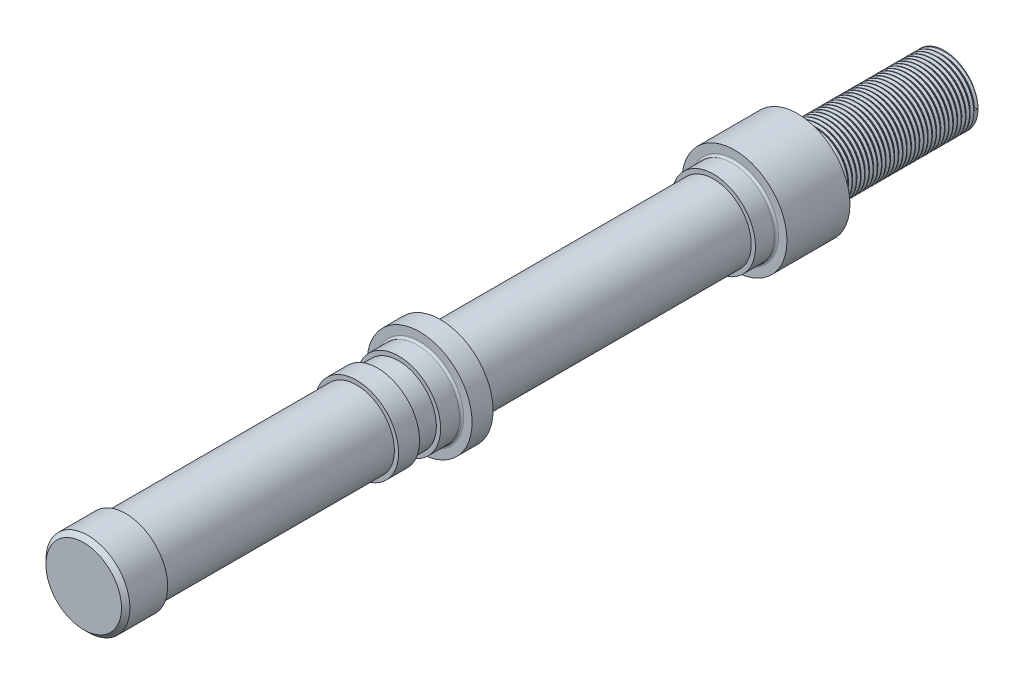
from build123d import *

# Parameters (mm, degrees)
SKETCH_1_R       = 8
EXTRUDE_1_DEPTH  = 35
SKETCH_2_R       = 12.5
EXTRUDE_2_DEPTH  = 15
SKETCH_3_R       = 10
EXTRUDE_3_DEPTH  = 5
SKETCH_4_R       = 9
EXTRUDE_4_DEPTH  = 65
SKETCH_5_R       = 12.5
EXTRUDE_5_DEPTH  = 5
SKETCH_6_R       = 10
EXTRUDE_6_DEPTH  = 5
SKETCH_7_R       = 9
EXTRUDE_7_DEPTH  = 5
SKETCH_8_R       = 10
EXTRUDE_8_DEPTH  = 5
SKETCH_9_R       = 9
EXTRUDE_9_DEPTH  = 55
SKETCH_10_R      = 10
EXTRUDE_10_DEPTH = 10
THREAD_1_PITCH   = 1
CHAMFER_1_SIZE   = 1
FILLET_1_R       = 0.5
FILLET_2_R       = 0.5


with BuildPart() as part:
    # Sketch 1 → ﾎﾞｽ - 押し出し1 (new body)
    with BuildSketch(Plane.XY):
        Circle(SKETCH_1_R)
    extrude(amount=EXTRUDE_1_DEPTH)

    # ｽｹｯﾁ2 → ﾎﾞｽ - 押し出し2 (add)
    with BuildSketch(Plane.XY.offset(35)):
        Circle(SKETCH_2_R)
    extrude(amount=EXTRUDE_2_DEPTH)

    # ｽｹｯﾁ3 → ﾎﾞｽ - 押し出し3 (add)
    with BuildSketch(Plane.XY.offset(50)):
        Circle(SKETCH_3_R)
    extrude(amount=EXTRUDE_3_DEPTH)

    # ｽｹｯﾁ4 → ﾎﾞｽ - 押し出し4 (add)
    with BuildSketch(Plane.XY.offset(55)):
        Circle(SKETCH_4_R)
    extrude(amount=EXTRUDE_4_DEPTH)

    # ｽｹｯﾁ5 → ﾎﾞｽ - 押し出し5 (add)
    with BuildSketch(Plane.XY.offset(120)):
        Circle(SKETCH_5_R)
    extrude(amount=EXTRUDE_5_DEPTH)

    # ｽｹｯﾁ6 → ﾎﾞｽ - 押し出し6 (add)
    with BuildSketch(Plane.XY.offset(125)):
        Circle(SKETCH_6_R)
    extrude(amount=EXTRUDE_6_DEPTH)

    # ｽｹｯﾁ7 → ﾎﾞｽ - 押し出し7 (add)
    with BuildSketch(Plane.XY.offset(130)):
        Circle(SKETCH_7_R)
    extrude(amount=EXTRUDE_7_DEPTH)

    # ｽｹｯﾁ8 → ﾎﾞｽ - 押し出し8 (add)
    with BuildSketch(Plane.XY.offset(135)):
        Circle(SKETCH_8_R)
    extrude(amount=EXTRUDE_8_DEPTH)

    # ｽｹｯﾁ9 → ﾎﾞｽ - 押し出し9 (add)
    with BuildSketch(Plane.XY.offset(140)):
        Circle(SKETCH_9_R)
    extrude(amount=EXTRUDE_9_DEPTH)

    # ｽｹｯﾁ10 → ﾎﾞｽ - 押し出し10 (add)
    with BuildSketch(Plane.XY.offset(195)):
        Circle(SKETCH_10_R)
    extrude(amount=EXTRUDE_10_DEPTH)

    # ねじ山1: the profile of Sketch 1 2 profile screwed along a right-hand helix of 35 turns, 8 arcs to a turn; built about Z, then put on its axis
    thread_1_z = Axis((0, 0, 0), (0, 0, 1))
    thread_1_corners = [(8.0003, 0, -0.000173205), (8.0003, 0, 0.875173202), (7.458734125, 0, 0.562499999), (7.458734125, 0, 0.312499999)]
    with BuildLine(mode=Mode.PRIVATE) as thread_1_profile:
        Line(thread_1_corners[0], thread_1_corners[1])
        Line(thread_1_corners[1], thread_1_corners[2])
        Line(thread_1_corners[2], thread_1_corners[3])
        Line(thread_1_corners[3], thread_1_corners[0])
    thread_1_cap = Face(thread_1_profile.wire())
    thread_1_turn_angles = [0, 22.5, 45, 67.5, 90, 112.5, 135, 157.5, 180, 202.5, 225, 247.5, 270, 292.5, 315, 337.5, 360]
    thread_1_turn_weights = [1, 0.9238795325112867, 1, 0.9238795325112867, 1, 0.9238795325112867, 1, 0.9238795325112867, 1, 0.9238795325112867, 1, 0.9238795325112867, 1, 0.9238795325112867, 1, 0.9238795325112867, 1]
    thread_1_turn_rails = [Edge.make_bspline([Vector(p[0], p[1], 0).rotate(thread_1_z, thread_1_turn_angles[k]) / thread_1_turn_weights[k] + Vector(0, 0, p[2] + THREAD_1_PITCH * thread_1_turn_angles[k] / 360) for k in range(17)], [0, 0, 0, 1, 1, 2, 2, 3, 3, 4, 4, 5, 5, 6, 6, 7, 7, 8, 8, 8], 2, thread_1_turn_weights) for p in thread_1_corners]
    thread_1_turn_sides = [Face.make_surface_from_curves(thread_1_turn_rails[p[0]], thread_1_turn_rails[p[1]]) for p in [(0, 1), (1, 2), (2, 3), (3, 0)]]
    thread_1 = Plane(origin=(0, 0, 0), x_dir=(1, 0, 0), z_dir=(0, 0, 1)) * Solid(Shell([*[p.moved(Location((0, 0, THREAD_1_PITCH * i))) for i in range(35) for p in thread_1_turn_sides], thread_1_cap, thread_1_cap.rotate(thread_1_z, 12600).moved(Location((0, 0, THREAD_1_PITCH * 12600 / 360)))]))
    add(thread_1, mode=Mode.SUBTRACT)

    # 面取り1
    chamfer_1_edges = [part.edges().sort_by_distance(p)[0] for p in [
        (-10, 0, 205),
    ]]
    chamfer(chamfer_1_edges, length=CHAMFER_1_SIZE)

    # ﾌｨﾚｯﾄ1
    fillet_1_edges = [part.edges().sort_by_distance(p)[0] for p in [
        (-10, 0, 125),
    ]]
    fillet(fillet_1_edges, radius=FILLET_1_R)

    # ﾌｨﾚｯﾄ2
    fillet_2_edges = [part.edges().sort_by_distance(p)[0] for p in [
        (-10, 0, 50),
    ]]
    fillet(fillet_2_edges, radius=FILLET_2_R)


solid = part.part
